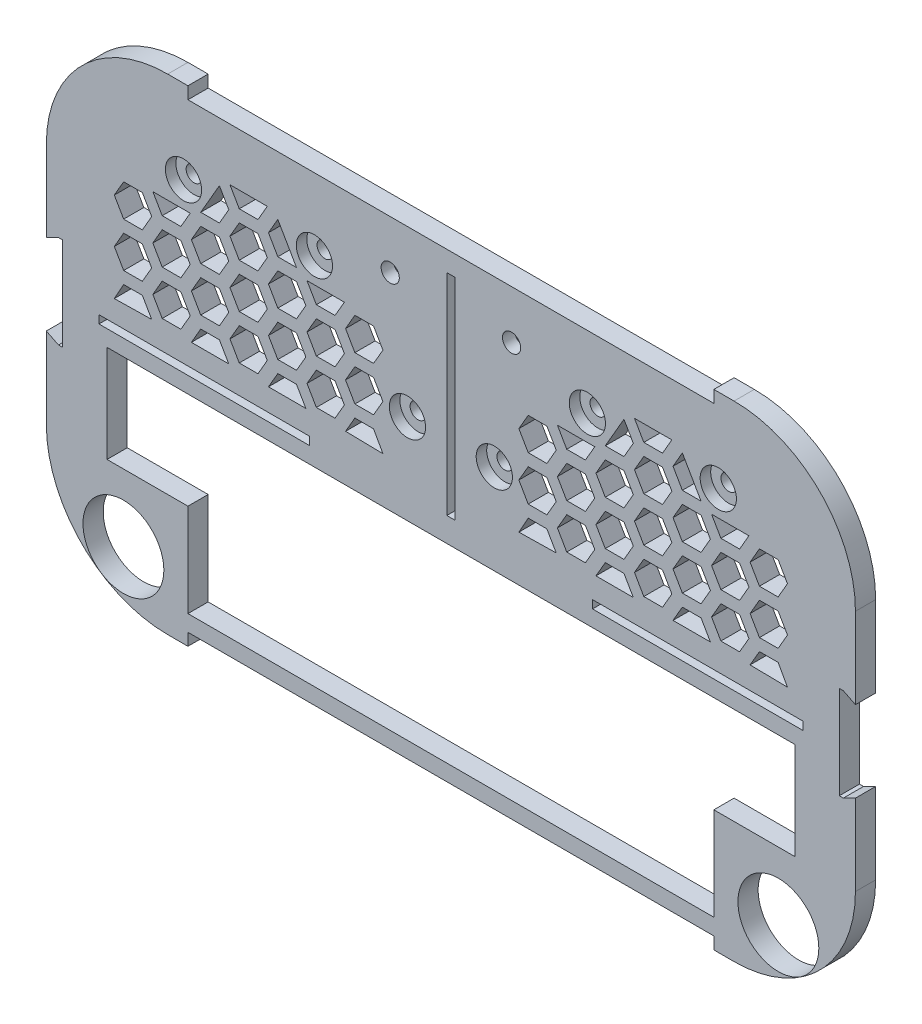
from build123d import *

# Parameters (mm, degrees)
EXTRUDE_1_DEPTH                = 5
SKETCH_2_R                     = 10
CUT_EXTRUDE_538_DEPTH          = 4
CUT_EXTRUDE_583_REACH          = 118.726
SKETCH_2_3_R                   = 10
CUT_EXTRUDE_4_REACH            = 118.726
SKETCH_3_W                     = 130
SKETCH_3_H                     = 3
HOLE_WIZARD_M3_5_1_D           = 3.9
HOLE_WIZARD_M3_5_1_CBORE_D     = 8.96
HOLE_WIZARD_M3_5_1_CBORE_DEPTH = 2.6
CUT_EXTRUDE_5_DEPTH            = 117.726175299
CUT_EXTRUDE_5_DEPTH_BACK       = 117.726175299
SKETCH_8_R                     = 5
SKETCH_8_W                     = 40
SKETCH_8_H                     = 5
CUT_EXTRUDE_7_DEPTH            = 3
HOLE_WIZARD_M4_1_D             = 4.5
HOLE_WIZARD_M4_1_CBORE_D       = 8
HOLE_WIZARD_M4_1_CBORE_DEPTH   = 2


with BuildPart() as part:
    # 草图1 → 凸台-拉伸1 (new body)
    with BuildSketch(Plane.XY):
        with BuildLine():
            Line((70, 60), (-70, 60))
            ThreePointArc((-70, 60), (-91.213203436, 51.213203436), (-100, 30))
            Line((-100, 30), (-100, -30))
            ThreePointArc((-100, -30), (-91.213203436, -51.213203436), (-70, -60))
            Line((-70, -60), (70, -60))
            ThreePointArc((70, -60), (91.213203436, -51.213203436), (100, -30))
            Line((100, -30), (100, 30))
            ThreePointArc((100, 30), (91.213203436, 51.213203436), (70, 60))
        make_face()
    extrude(amount=EXTRUDE_1_DEPTH)

    # 草图2 → Cut-Extrude 538 (cut)
    with BuildSketch(Plane.XY):
        with Locations((-80.94997709, 46.6721258)):
            Circle(SKETCH_2_R)
        with Locations((80.94997709, 46.6721258)):
            Circle(SKETCH_2_R)
    extrude(amount=CUT_EXTRUDE_538_DEPTH, mode=Mode.SUBTRACT)

    # 草图2<3> → Cut-Extrude 583 (cut, up to next)
    with BuildSketch(Plane.XY, mode=Mode.PRIVATE) as cut_extrude_583_sk1:
        with Locations((80.94997709, -46.6721258)):
            Circle(SKETCH_2_3_R)
    cut_extrude_583_tool1 = extrude(cut_extrude_583_sk1.sketch, amount=CUT_EXTRUDE_583_REACH, mode=Mode.PRIVATE) & part.part
    # 草图2<3> → Cut-Extrude 583 (cut, up to next)
    with BuildSketch(Plane.XY, mode=Mode.PRIVATE) as cut_extrude_583_sk2:
        with Locations((-80.94997709, -46.6721258)):
            Circle(SKETCH_2_3_R)
    cut_extrude_583_tool2 = extrude(cut_extrude_583_sk2.sketch, amount=CUT_EXTRUDE_583_REACH, mode=Mode.PRIVATE) & part.part
    add(cut_extrude_583_tool1.solids().sort_by_distance((80.949977, -46.672126, 0))[0], mode=Mode.SUBTRACT)
    add(cut_extrude_583_tool2.solids().sort_by_distance((-80.949977, -46.672126, 0))[0], mode=Mode.SUBTRACT)

    # 草图3 → 切除-拉伸4 (cut, up to next)
    with BuildSketch(Plane.XY, mode=Mode.PRIVATE) as cut_extrude_4_sk1:
        Polygon((-85, -6), (-85, -30), (-70, -30), (-65, -30), (-65, -53), (65, -53), (65, -30), (70, -30), (85, -30), (85, -6), align=None)
    cut_extrude_4_tool1 = extrude(cut_extrude_4_sk1.sketch, amount=CUT_EXTRUDE_4_REACH, mode=Mode.PRIVATE) & part.part
    # 草图3 → 切除-拉伸4 (cut, up to next)
    with BuildSketch(Plane.XY, mode=Mode.PRIVATE) as cut_extrude_4_sk2:
        with Locations((0, -58.5)):
            Rectangle(SKETCH_3_W, SKETCH_3_H)
    cut_extrude_4_tool2 = extrude(cut_extrude_4_sk2.sketch, amount=CUT_EXTRUDE_4_REACH, mode=Mode.PRIVATE) & part.part
    # 草图3 → 切除-拉伸4 (cut, up to next)
    with BuildSketch(Plane.XY, mode=Mode.PRIVATE) as cut_extrude_4_sk3:
        Polygon((-100, -10), (-97, -11.5), (-96, -11.5), (-96, 11.5), (-97, 11.5), (-100, 10), align=None)
    cut_extrude_4_tool3 = extrude(cut_extrude_4_sk3.sketch, amount=CUT_EXTRUDE_4_REACH, mode=Mode.PRIVATE) & part.part
    # 草图3 → 切除-拉伸4 (cut, up to next)
    with BuildSketch(Plane.XY, mode=Mode.PRIVATE) as cut_extrude_4_sk4:
        Polygon((87, 0), (87, -2), (35, -2), (35, 0), (37, 0), align=None)
    cut_extrude_4_tool4 = extrude(cut_extrude_4_sk4.sketch, amount=CUT_EXTRUDE_4_REACH, mode=Mode.PRIVATE) & part.part
    # 草图3 → 切除-拉伸4 (cut, up to next)
    with BuildSketch(Plane.XY, mode=Mode.PRIVATE) as cut_extrude_4_sk5:
        Polygon((-35, 0), (-35, -2), (-87, -2), (-87, 0), (-37, 0), align=None)
    cut_extrude_4_tool5 = extrude(cut_extrude_4_sk5.sketch, amount=CUT_EXTRUDE_4_REACH, mode=Mode.PRIVATE) & part.part
    # 草图3 → 切除-拉伸4 (cut, up to next)
    with BuildSketch(Plane.XY, mode=Mode.PRIVATE) as cut_extrude_4_sk6:
        Polygon((97, 11.5), (96, 11.5), (96, -11.5), (97, -11.5), (100, -10), (100, 10), align=None)
    cut_extrude_4_tool6 = extrude(cut_extrude_4_sk6.sketch, amount=CUT_EXTRUDE_4_REACH, mode=Mode.PRIVATE) & part.part
    # 草图3 → 切除-拉伸4 (cut, up to next)
    with BuildSketch(Plane.XY, mode=Mode.PRIVATE) as cut_extrude_4_sk7:
        Polygon((0, 0), (-1, 0), (-1, 50), (-1, 52), (1, 52), (1, 50), (1, 0), align=None)
    cut_extrude_4_tool7 = extrude(cut_extrude_4_sk7.sketch, amount=CUT_EXTRUDE_4_REACH, mode=Mode.PRIVATE) & part.part
    # 草图3 → 切除-拉伸4 (cut, up to next)
    with BuildSketch(Plane.XY, mode=Mode.PRIVATE) as cut_extrude_4_sk8:
        with Locations((0, 58.5)):
            Rectangle(SKETCH_3_W, SKETCH_3_H)
    cut_extrude_4_tool8 = extrude(cut_extrude_4_sk8.sketch, amount=CUT_EXTRUDE_4_REACH, mode=Mode.PRIVATE) & part.part
    add(cut_extrude_4_tool1.solids().sort_by_distance((0, -27.938472, 0))[0], mode=Mode.SUBTRACT)
    add(cut_extrude_4_tool2.solids().sort_by_distance((0, -58.5, 0))[0], mode=Mode.SUBTRACT)
    add(cut_extrude_4_tool3.solids().sort_by_distance((-97.948571, 0, 0))[0], mode=Mode.SUBTRACT)
    add(cut_extrude_4_tool4.solids().sort_by_distance((61, -1, 0))[0], mode=Mode.SUBTRACT)
    add(cut_extrude_4_tool5.solids().sort_by_distance((-61, -1, 0))[0], mode=Mode.SUBTRACT)
    add(cut_extrude_4_tool6.solids().sort_by_distance((97.948571, 0, 0))[0], mode=Mode.SUBTRACT)
    add(cut_extrude_4_tool7.solids().sort_by_distance((0, 26, 0))[0], mode=Mode.SUBTRACT)
    add(cut_extrude_4_tool8.solids().sort_by_distance((0, 58.5, 0))[0], mode=Mode.SUBTRACT)

    # M3.5 六角头机械螺钉的柱形沉头孔1 (through all)
    with Locations(Plane(origin=(-66.09513153, 39.33442184, 5), x_dir=(1, 0, 0), z_dir=(0, 0, 1))):
        with Locations((0, 0), (32.35917741, -0.06954171), (55.361697855, -23.07037596), (99.83108565, -0.06954171), (76.8285652, -23.07037596), (132.19026306, 0)):
            CounterBoreHole(HOLE_WIZARD_M3_5_1_D / 2, HOLE_WIZARD_M3_5_1_CBORE_D / 2, HOLE_WIZARD_M3_5_1_CBORE_DEPTH)

    # 草图5 → 切除-拉伸5 (cut, two sides: drawn at the far end of the back side and taken through both)
    with BuildSketch(Plane.XY.offset(-CUT_EXTRUDE_5_DEPTH_BACK)):
        Polygon((-35.854918405, 5.5), (-38.164319482, 9.5), (-42.783121635, 9.5), (-45.092522712, 5.5), align=None)
        Polygon((-26.328638963, 11), (-28.63804004, 15), (-33.256842194, 15), (-35.56624327, 11), (-33.256842194, 7), (-28.63804004, 7), align=None)
        Polygon((-16.802359522, 16.5), (-19.111760598, 20.5), (-23.730562752, 20.5), (-26.039963829, 16.5), (-23.730562752, 12.5), (-19.111760598, 12.5), align=None)
        Polygon((-35.854918405, 16.5), (-38.164319482, 20.5), (-42.783121635, 20.5), (-45.092522712, 16.5), (-42.783121635, 12.5), (-38.164319482, 12.5), align=None)
        Polygon((-26.328638963, 22), (-28.63804004, 26), (-33.256842194, 26), (-35.56624327, 22), (-33.256842194, 18), (-28.63804004, 18), align=None)
        Polygon((-16.802359522, 27.5), (-19.111760598, 31.5), (-23.730562752, 31.5), (-26.039963829, 27.5), (-23.730562752, 23.5), (-19.111760598, 23.5), align=None)
        Polygon((-35.854918405, 27.5), (-38.164319482, 31.5), (-42.783121635, 31.5), (-45.092522712, 27.5), (-42.783121635, 23.5), (-38.164319482, 23.5), align=None)
        Polygon((-35.56624327, 33), (-33.256842194, 29), (-28.63804004, 29), (-26.328638963, 33), align=None)
        Polygon((-42.783121635, 42.5), (-45.092522712, 38.5), (-42.783121635, 34.5), (-38.164319482, 34.5), align=None)
        Polygon((-45.381197846, 11), (-47.690598923, 15), (-52.309401077, 15), (-54.618802154, 11), (-52.309401077, 7), (-47.690598923, 7), align=None)
        Polygon((-45.381197846, 22), (-47.690598923, 26), (-52.309401077, 26), (-54.618802154, 22), (-52.309401077, 18), (-47.690598923, 18), align=None)
        Polygon((-45.381197846, 33), (-47.690598923, 37), (-52.309401077, 37), (-54.618802154, 33), (-52.309401077, 29), (-47.690598923, 29), align=None)
        Polygon((-54.907477288, 5.5), (-64.145081595, 5.5), (-61.835680518, 9.5), (-57.216878365, 9.5), align=None)
        Polygon((-64.43375673, 33), (-73.671361037, 33), (-71.36195996, 29), (-66.743157806, 29), align=None)
        Polygon((-57.216878365, 42.5), (-61.835680518, 34.5), (-57.216878365, 34.5), (-54.907477288, 38.5), align=None)
        Polygon((-61.835680518, 23.5), (-64.145081595, 27.5), (-61.835680518, 31.5), (-57.216878365, 31.5), (-54.907477288, 27.5), (-57.216878365, 23.5), align=None)
        Polygon((-80.888239402, 23.5), (-83.197640478, 27.5), (-80.888239402, 31.5), (-76.269437248, 31.5), (-73.960036171, 27.5), (-76.269437248, 23.5), align=None)
        Polygon((-71.36195996, 18), (-73.671361037, 22), (-71.36195996, 26), (-66.743157806, 26), (-64.43375673, 22), (-66.743157806, 18), align=None)
        Polygon((-61.835680518, 12.5), (-64.145081595, 16.5), (-61.835680518, 20.5), (-57.216878365, 20.5), (-54.907477288, 16.5), (-57.216878365, 12.5), align=None)
        Polygon((-80.888239402, 12.5), (-83.197640478, 16.5), (-80.888239402, 20.5), (-76.269437248, 20.5), (-73.960036171, 16.5), (-76.269437248, 12.5), align=None)
        Polygon((-71.36195996, 7), (-73.671361037, 11), (-71.36195996, 15), (-66.743157806, 15), (-64.43375673, 11), (-66.743157806, 7), align=None)
        Polygon((-52.309401077, 40), (-47.690598923, 40), (-45.381197846, 44), (-52.309401077, 44), (-54.618802154, 44), align=None)
        Polygon((-21.421161675, 9.5), (-23.730562752, 9.5), (-26.039963829, 5.5), (-16.802359522, 5.34174435), (-19.111760598, 9.5), align=None)
        Polygon((-80.888239402, 9.5), (-78.578838325, 9.5), (-76.269437248, 9.5), (-73.960036171, 5.5), (-83.197640478, 5.34174435), align=None)
        Polygon((78.578838325, 9.5), (76.269437248, 9.5), (73.960036171, 5.5), (83.197640478, 5.34174435), (80.888239402, 9.5), align=None)
        Polygon((19.111760598, 9.5), (21.421161675, 9.5), (23.730562752, 9.5), (26.039963829, 5.5), (16.802359522, 5.34174435), align=None)
        Polygon((45.381197846, 44), (47.690598923, 40), (52.309401077, 40), (54.618802154, 44), (52.309401077, 44), align=None)
        Polygon((64.145081595, 5.5), (61.835680518, 9.5), (57.216878365, 9.5), (54.907477288, 5.5), align=None)
        Polygon((73.671361037, 11), (71.36195996, 15), (66.743157806, 15), (64.43375673, 11), (66.743157806, 7), (71.36195996, 7), align=None)
        Polygon((83.197640478, 16.5), (80.888239402, 20.5), (76.269437248, 20.5), (73.960036171, 16.5), (76.269437248, 12.5), (80.888239402, 12.5), align=None)
        Polygon((64.145081595, 16.5), (61.835680518, 20.5), (57.216878365, 20.5), (54.907477288, 16.5), (57.216878365, 12.5), (61.835680518, 12.5), align=None)
        Polygon((73.671361037, 22), (71.36195996, 26), (66.743157806, 26), (64.43375673, 22), (66.743157806, 18), (71.36195996, 18), align=None)
        Polygon((83.197640478, 27.5), (80.888239402, 31.5), (76.269437248, 31.5), (73.960036171, 27.5), (76.269437248, 23.5), (80.888239402, 23.5), align=None)
        Polygon((64.145081595, 27.5), (61.835680518, 31.5), (57.216878365, 31.5), (54.907477288, 27.5), (57.216878365, 23.5), (61.835680518, 23.5), align=None)
        Polygon((64.43375673, 33), (66.743157806, 29), (71.36195996, 29), (73.671361037, 33), align=None)
        Polygon((57.216878365, 42.5), (54.907477288, 38.5), (57.216878365, 34.5), (61.835680518, 34.5), align=None)
        Polygon((45.092522712, 5.5), (35.854918405, 5.5), (38.164319482, 9.5), (42.783121635, 9.5), align=None)
        Polygon((35.56624327, 33), (26.328638963, 33), (28.63804004, 29), (33.256842194, 29), align=None)
        Polygon((42.783121635, 42.5), (38.164319482, 34.5), (42.783121635, 34.5), (45.092522712, 38.5), align=None)
        Polygon((47.690598923, 29), (45.381197846, 33), (47.690598923, 37), (52.309401077, 37), (54.618802154, 33), (52.309401077, 29), align=None)
        Polygon((47.690598923, 18), (45.381197846, 22), (47.690598923, 26), (52.309401077, 26), (54.618802154, 22), (52.309401077, 18), align=None)
        Polygon((47.690598923, 7), (45.381197846, 11), (47.690598923, 15), (52.309401077, 15), (54.618802154, 11), (52.309401077, 7), align=None)
        Polygon((38.164319482, 23.5), (35.854918405, 27.5), (38.164319482, 31.5), (42.783121635, 31.5), (45.092522712, 27.5), (42.783121635, 23.5), align=None)
        Polygon((19.111760598, 23.5), (16.802359522, 27.5), (19.111760598, 31.5), (23.730562752, 31.5), (26.039963829, 27.5), (23.730562752, 23.5), align=None)
        Polygon((28.63804004, 18), (26.328638963, 22), (28.63804004, 26), (33.256842194, 26), (35.56624327, 22), (33.256842194, 18), align=None)
        Polygon((38.164319482, 12.5), (35.854918405, 16.5), (38.164319482, 20.5), (42.783121635, 20.5), (45.092522712, 16.5), (42.783121635, 12.5), align=None)
        Polygon((19.111760598, 12.5), (16.802359522, 16.5), (19.111760598, 20.5), (23.730562752, 20.5), (26.039963829, 16.5), (23.730562752, 12.5), align=None)
        Polygon((28.63804004, 7), (26.328638963, 11), (28.63804004, 15), (33.256842194, 15), (35.56624327, 11), (33.256842194, 7), align=None)
    extrude(amount=CUT_EXTRUDE_5_DEPTH + CUT_EXTRUDE_5_DEPTH_BACK, mode=Mode.SUBTRACT)

    # 草图8 → 切除-拉伸7 (cut)
    # profile 1 of 4: a face of its own
    with BuildSketch(Plane.XY):
        Polygon((-6, 22), (-1, 22), (-1, 52), (-24, 52), (-24, 47), align=None)
        with Locations((-15, 45)):
            Circle(SKETCH_8_R, mode=Mode.SUBTRACT)
    # profile 2 of 4: a face of its own
    with BuildSketch(Plane.XY):
        with Locations((-46, 49.5)):
            Rectangle(SKETCH_8_W, SKETCH_8_H)
    # profile 3 of 4: a face of its own
    with BuildSketch(Plane.XY):
        Polygon((24, 47), (6, 22), (1, 22), (1, 52), (24, 52), align=None)
        with Locations((15, 45)):
            Circle(SKETCH_8_R, mode=Mode.SUBTRACT)
    # profile 4 of 4: a face of its own
    with BuildSketch(Plane.XY):
        with Locations((46, 49.5)):
            Rectangle(SKETCH_8_W, SKETCH_8_H)
    extrude(amount=CUT_EXTRUDE_7_DEPTH, mode=Mode.SUBTRACT)

    # M4 六角凹头盖的柱孔1 (through all)
    with Locations(Plane(origin=(-15, 45, 0), x_dir=(-1, 0, 0), z_dir=(0, 0, -1))):
        with Locations((0, 0), (-30, 0)):
            CounterBoreHole(HOLE_WIZARD_M4_1_D / 2, HOLE_WIZARD_M4_1_CBORE_D / 2, HOLE_WIZARD_M4_1_CBORE_DEPTH)


solid = part.part
